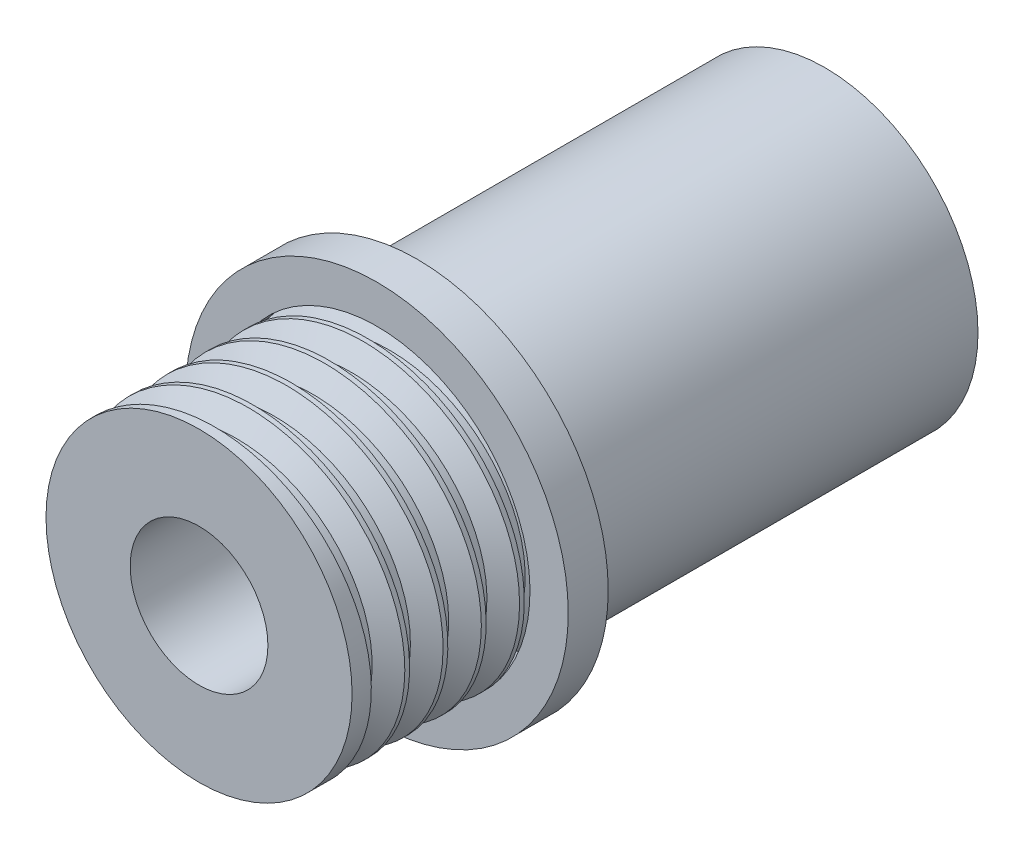
from build123d import *
from build123d.topology import SkipClean

# Parameters (mm, degrees)
THREAD1_PITCH      = 1
SKETCH12_R         = 1.8
CUT_EXTRUDE1_DEPTH = 10


with BuildPart() as part:
    # Sketch2 → Revolve1 (revolve)
    with BuildSketch(Plane(origin=(0, 0, 0), x_dir=(0, 0, -1), z_dir=(1, 0, 0))):
        Polygon((0, 0), (0, 4), (4.65, 4), (4.65, 5), (5.694565217, 5), (5.694565217, 4), (16.36, 4), (16.36, 0), align=None)
    revolve(axis=Axis((0, 0, -16.36), (0, 0, 1)))

    # Thread1: the profile of Thread Profile1 profile screwed along a right-hand helix of 4.6 turns, 8 arcs to a turn; built about Z, then put on its axis
    with SkipClean():  # the faces are left unmerged after this step: merging them gives an invalid solid
        thread1_z = Axis((0, 0, 0), (0, 0, 1))
        thread1_corners = [(4.0003, 0, -0.000173205), (4.0003, 0, 0.875173202), (3.458734125, 0, 0.562499999), (3.458734125, 0, 0.312499999)]
        with BuildLine(mode=Mode.PRIVATE) as thread1_profile:
            Line(thread1_corners[0], thread1_corners[1])
            Line(thread1_corners[1], thread1_corners[2])
            Line(thread1_corners[2], thread1_corners[3])
            Line(thread1_corners[3], thread1_corners[0])
        thread1_cap = Face(thread1_profile.wire())
        thread1_turn_angles = [0, 22.5, 45, 67.5, 90, 112.5, 135, 157.5, 180, 202.5, 225, 247.5, 270, 292.5, 315, 337.5, 360]
        thread1_turn_weights = [1, 0.9238795325112867, 1, 0.9238795325112867, 1, 0.9238795325112867, 1, 0.9238795325112867, 1, 0.9238795325112867, 1, 0.9238795325112867, 1, 0.9238795325112867, 1, 0.9238795325112867, 1]
        thread1_turn_rails = [Edge.make_bspline([Vector(p[0], p[1], 0).rotate(thread1_z, thread1_turn_angles[k]) / thread1_turn_weights[k] + Vector(0, 0, p[2] + THREAD1_PITCH * thread1_turn_angles[k] / 360) for k in range(17)], [0, 0, 0, 1, 1, 2, 2, 3, 3, 4, 4, 5, 5, 6, 6, 7, 7, 8, 8, 8], 2, thread1_turn_weights) for p in thread1_corners]
        thread1_turn_sides = [Face.make_surface_from_curves(thread1_turn_rails[p[0]], thread1_turn_rails[p[1]]) for p in [(0, 1), (1, 2), (2, 3), (3, 0)]]
        thread1_last_angles = [1440, 1462.5, 1485, 1507.5, 1530, 1552.5, 1575, 1597.5, 1620, 1638, 1656]
        thread1_last_weights = [1, 0.9238795325112867, 1, 0.9238795325112867, 1, 0.9238795325112867, 1, 0.9238795325112867, 1, 0.9510565162951542, 1]
        thread1_last_rails = [Edge.make_bspline([Vector(p[0], p[1], 0).rotate(thread1_z, thread1_last_angles[k]) / thread1_last_weights[k] + Vector(0, 0, p[2] + THREAD1_PITCH * thread1_last_angles[k] / 360) for k in range(11)], [0, 0, 0, 1, 1, 2, 2, 3, 3, 4, 4, 5, 5, 5], 2, thread1_last_weights) for p in thread1_corners]
        thread1_last_sides = [Face.make_surface_from_curves(thread1_last_rails[p[0]], thread1_last_rails[p[1]]) for p in [(0, 1), (1, 2), (2, 3), (3, 0)]]
        thread1 = Plane(origin=(0, 0, 0), x_dir=(-1, 0, 0), z_dir=(0, 0, -1)) * Solid(Shell([*[p.moved(Location((0, 0, THREAD1_PITCH * i))) for i in range(4) for p in thread1_turn_sides], *thread1_last_sides, thread1_cap, thread1_cap.rotate(thread1_z, 1656).moved(Location((0, 0, THREAD1_PITCH * 1656 / 360)))]))
        add(thread1, mode=Mode.SUBTRACT)

    # Sketch12 → Cut-Extrude1 (cut)
    with SkipClean():  # the faces are left unmerged after this step: merging them gives an invalid solid
        with BuildSketch(Plane.XY):
            Circle(SKETCH12_R)
        extrude(amount=-CUT_EXTRUDE1_DEPTH, mode=Mode.SUBTRACT)


solid = part.part
